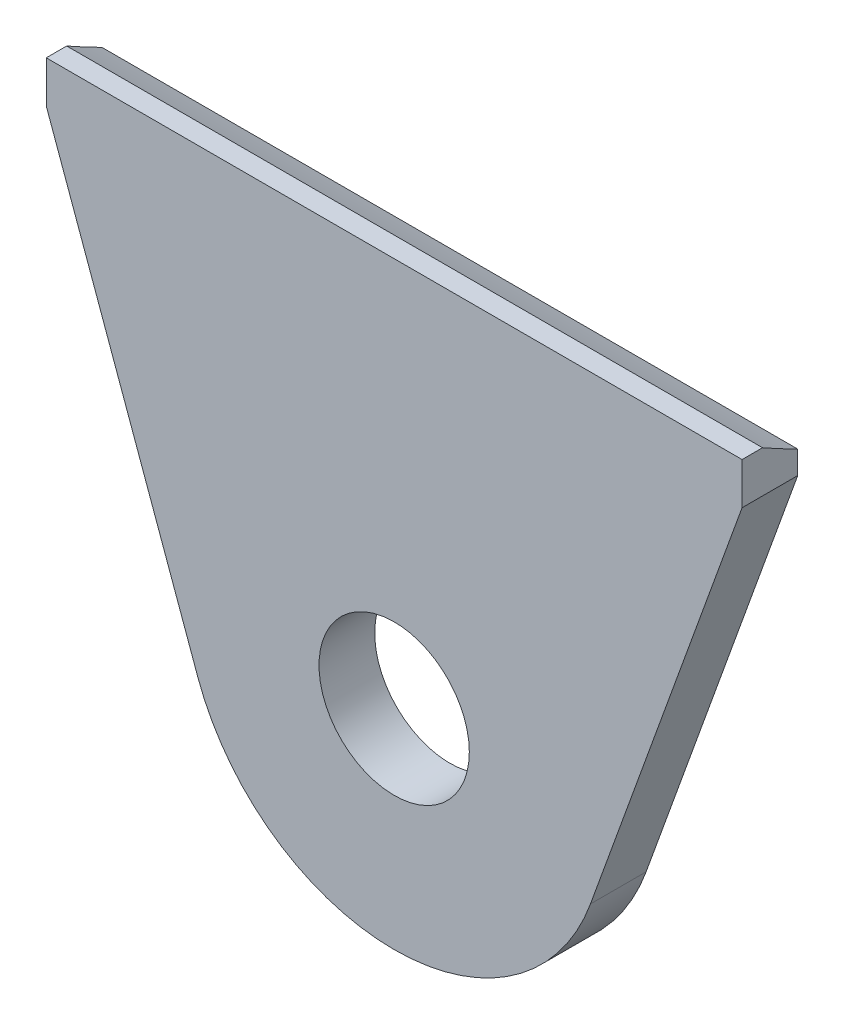
from build123d import *

# Parameters (mm, degrees)
SKETCH_1_R                 = 5.4
EXTRUDE_1_DEPTH            = 4
CUT_EXTRUDE_534_DEPTH      = 38.749172176
CUT_EXTRUDE_534_DEPTH_BACK = 38.749172176
SKETCH_514_R               = 66.5


with BuildPart() as part:
    # Эскиз1 → Бобышка-Вытянуть1 (new body)
    with BuildSketch(Plane.XY):
        with BuildLine():
            Line((-25, 28), (25, 28))
            Line((25, 28), (25, 25))
            Line((25, 25), (14.104686356, -5.104686356))
            ThreePointArc((14.104686356, -5.104686356), (0, -15), (-14.104686356, -5.104686356))
            Line((-14.104686356, -5.104686356), (-25, 25))
            Line((-25, 25), (-25, 28))
        make_face()
        Circle(SKETCH_1_R, mode=Mode.SUBTRACT)
    extrude(amount=EXTRUDE_1_DEPTH)

    # Sketch 514 → Cut-Extrude 534 (cut, two sides: drawn at the far end of the back side and taken through both)
    with BuildSketch(Plane(origin=(0, 0, 0), x_dir=(0, 0, -1), z_dir=(1, 0, 0)).offset(-CUT_EXTRUDE_534_DEPTH_BACK)):
        with Locations((30, 86)):
            Circle(SKETCH_514_R)
    extrude(amount=CUT_EXTRUDE_534_DEPTH + CUT_EXTRUDE_534_DEPTH_BACK, mode=Mode.SUBTRACT)


solid = part.part
